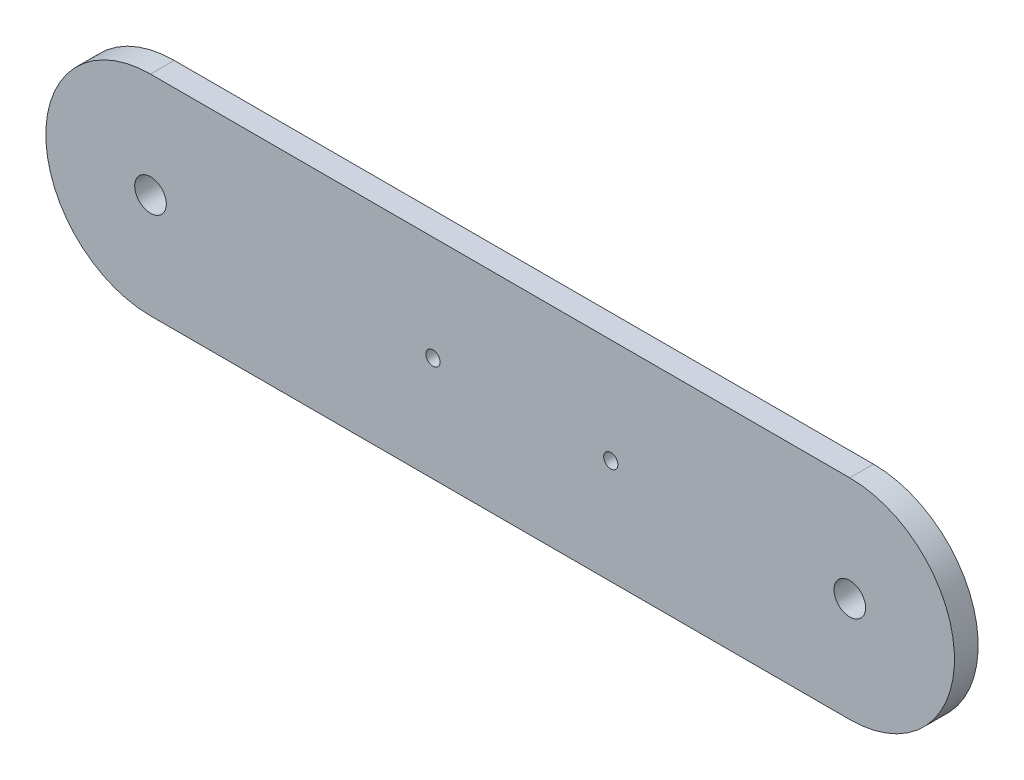
from build123d import *

# Parameters (mm, degrees)
ESBO_O1_R                = 4
ESBO_O1_R_2              = 1.8
RESSALTO_EXTRUS_O1_DEPTH = 6


with BuildPart() as part:
    # Esboço1 → Ressalto-extrusão1 (new body)
    with BuildSketch(Plane.XY):
        with BuildLine():
            Line((-94, 26.5), (83, 26.5))
            ThreePointArc((83, 26.5), (109.5, 0), (83, -26.5))
            Line((83, -26.5), (-94, -26.5))
            ThreePointArc((-94, -26.5), (-120.5, 0), (-94, 26.5))
        make_face()
        with Locations((-94, 0)):
            Circle(ESBO_O1_R, mode=Mode.SUBTRACT)
        with Locations((83, 0)):
            Circle(ESBO_O1_R, mode=Mode.SUBTRACT)
        with Locations((-22.5, 0)):
            Circle(ESBO_O1_R_2, mode=Mode.SUBTRACT)
        with Locations((22.5, 0)):
            Circle(ESBO_O1_R_2, mode=Mode.SUBTRACT)
    extrude(amount=RESSALTO_EXTRUS_O1_DEPTH)


solid = part.part
